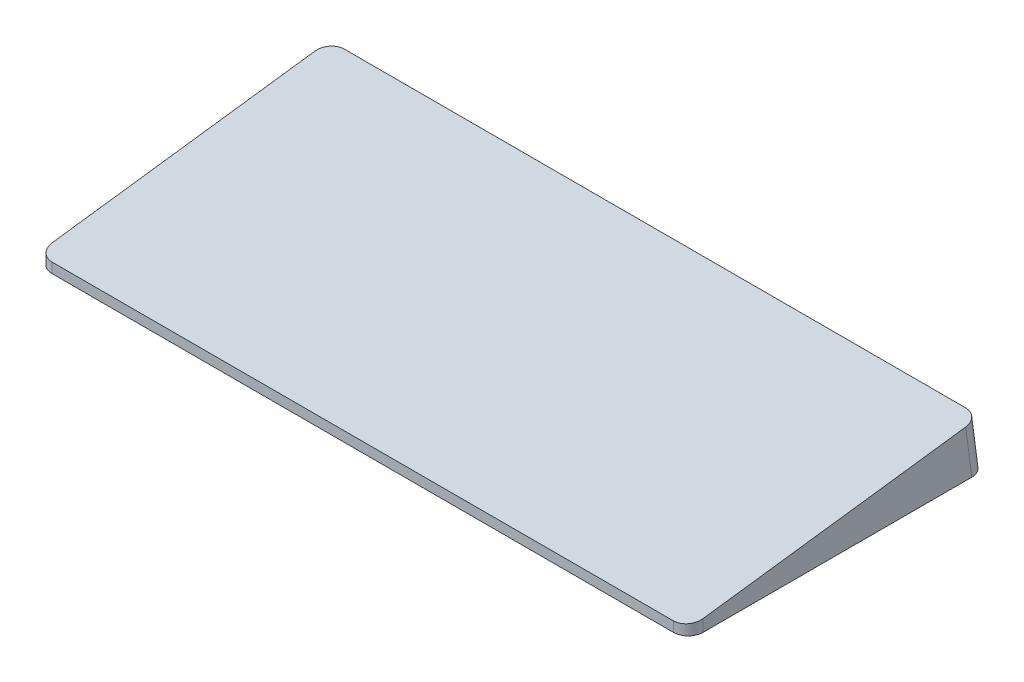
from build123d import *

# Parameters (mm, degrees)
SKETCH1_W               = 330
SKETCH1_H               = 151.33
BOSS_EXTRUDE1_DEPTH     = 25
CUT_EXTRUDE1_DEPTH      = 184.235346549
CUT_EXTRUDE1_DEPTH_BACK = 184.235346549
FILLET1_R               = 7.5
SKETCH3_W               = 250
SKETCH3_H               = 100
CUT_EXTRUDE2_DEPTH      = 3


with BuildPart() as part:
    # Sketch1 → Boss-Extrude1 (new body)
    with BuildSketch(Plane(origin=(0, 0, 0), x_dir=(1, 0, 0), z_dir=(0, 1, 0))):
        Rectangle(SKETCH1_W, SKETCH1_H)
    extrude(amount=BOSS_EXTRUDE1_DEPTH)

    # Sketch2 → Cut-Extrude1 (cut, two sides: drawn at the far end of the back side and taken through both)
    with BuildSketch(Plane(origin=(0, 0, 0), x_dir=(0, 0, -1), z_dir=(1, 0, 0)).offset(-CUT_EXTRUDE1_DEPTH_BACK)):
        Polygon((-75.665, 25), (-75.665, 5.07702754), (72.429761936, 24.574072829), (75.665, 0), (75.665, 25), align=None)
    extrude(amount=CUT_EXTRUDE1_DEPTH + CUT_EXTRUDE1_DEPTH_BACK, mode=Mode.SUBTRACT)

    # Fillet1
    fillet1_edges = [part.edges().sort_by_distance(p)[0] for p in [
        (-165, 2.53851377, 75.665),
        (165, 2.53851377, 75.665),
        (-165, 12.287036414, -74.047380968),
        (165, 12.287036414, -74.047380968),
    ]]
    fillet(fillet1_edges, radius=FILLET1_R)

    # Sketch3 → Cut-Extrude2 (cut)
    with BuildSketch(Plane.XZ):
        with Locations((0, -20)):
            Rectangle(SKETCH3_W, SKETCH3_H)
    extrude(amount=-CUT_EXTRUDE2_DEPTH, mode=Mode.SUBTRACT)


solid = part.part
